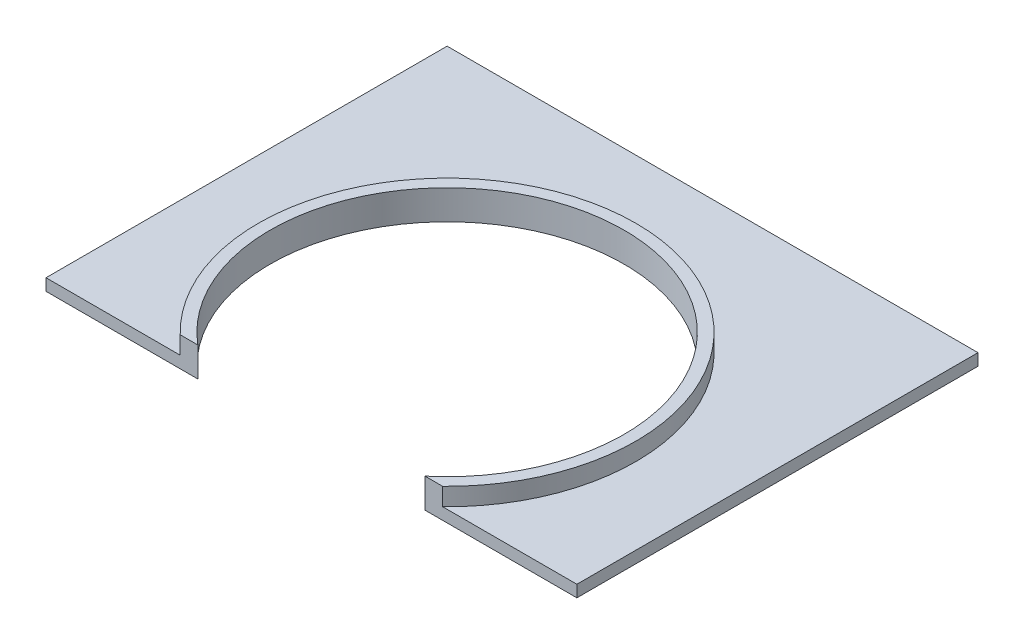
from build123d import *

# Parameters (mm, degrees)
CROQUIS1_W              = 90
CROQUIS1_H              = 90
CROQUIS1_R              = 30
SALIENTE_EXTRUIR1_DEPTH = 2
CROQUIS2_R              = 32
CROQUIS2_R_2            = 30
SALIENTE_EXTRUIR2_DEPTH = 3
CROQUIS3_W              = 90
CROQUIS3_H              = 22
CORTAR_EXTRUIR1_DEPTH   = 64.835726674


with BuildPart() as part:
    # Croquis1 → Saliente-Extruir1 (new body)
    with BuildSketch(Plane(origin=(0, 0, 0), x_dir=(1, 0, 0), z_dir=(0, 1, 0))):
        Rectangle(CROQUIS1_W, CROQUIS1_H)
        Circle(CROQUIS1_R, mode=Mode.SUBTRACT)
    extrude(amount=SALIENTE_EXTRUIR1_DEPTH)

    # Croquis2 → Saliente-Extruir2 (add)
    with BuildSketch(Plane(origin=(0, 2, 0), x_dir=(1, 0, 0), z_dir=(0, 1, 0))):
        Circle(CROQUIS2_R)
        Circle(CROQUIS2_R_2, mode=Mode.SUBTRACT)
    extrude(amount=SALIENTE_EXTRUIR2_DEPTH)

    # Croquis3 → Cortar-Extruir1 (cut, through all)
    with BuildSketch(Plane(origin=(0, 5, 0), x_dir=(1, 0, 0), z_dir=(0, 1, 0))):
        with Locations((0, -34)):
            Rectangle(CROQUIS3_W, CROQUIS3_H)
    extrude(amount=-CORTAR_EXTRUIR1_DEPTH, mode=Mode.SUBTRACT)


solid = part.part
